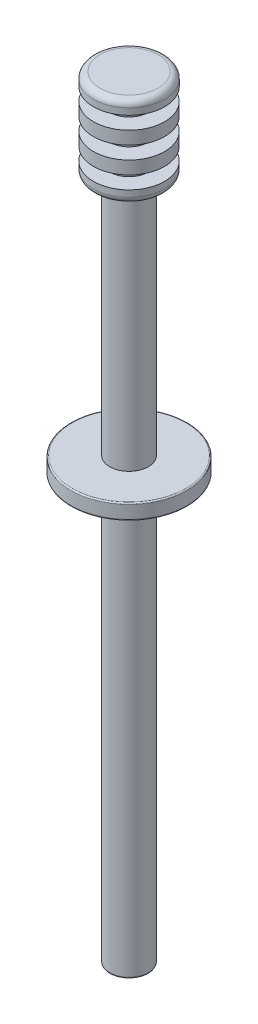
from build123d import *

# Parameters (mm, degrees)
SKETCH1_R            = 2.75
BOSS_EXTRUDE1_DEPTH  = 1
SKETCH2_R            = 1.5
BOSS_EXTRUDE2_DEPTH  = 1
BOSS_EXTRUDE3_START  = 1
SKETCH3_R            = 2.75
BOSS_EXTRUDE3_DEPTH  = 1
SKETCH4_R            = 1.5
BOSS_EXTRUDE4_DEPTH  = 1
BOSS_EXTRUDE5_START  = 1
SKETCH5_R            = 2.75
BOSS_EXTRUDE5_DEPTH  = 1
SKETCH6_R            = 1.5
BOSS_EXTRUDE6_DEPTH  = 1
BOSS_EXTRUDE7_START  = 1
SKETCH7_R            = 2.75
BOSS_EXTRUDE7_DEPTH  = 1
SKETCH8_R            = 1.5
BOSS_EXTRUDE8_DEPTH  = 18.75
SKETCH9_R            = 4.5
BOSS_EXTRUDE9_DEPTH  = 1.2
SKETCH10_R           = 1.5
BOSS_EXTRUDE10_DEPTH = 32.81
FILLET1_R            = 0.5
FILLET2_R            = 0.1
FILLET3_R            = 0.5
FILLET4_R            = 0.1


with BuildPart() as part:
    # Sketch1 → Boss-Extrude1 (new body)
    with BuildSketch(Plane(origin=(0, 0, 0), x_dir=(1, 0, 0), z_dir=(0, 1, 0))):
        Circle(SKETCH1_R)
    extrude(amount=BOSS_EXTRUDE1_DEPTH)

    # Sketch2 → Boss-Extrude2 (add)
    with BuildSketch(Plane.XZ):
        Circle(SKETCH2_R)
    extrude(amount=BOSS_EXTRUDE2_DEPTH)

    # Sketch3 → Boss-Extrude3 (add)
    with BuildSketch(Plane(origin=(0, -1, 0), x_dir=(-1, 0, 0), z_dir=(0, -1, 0)).offset(BOSS_EXTRUDE3_START)):
        Circle(SKETCH3_R)
    extrude(amount=-BOSS_EXTRUDE3_DEPTH)

    # Sketch4 → Boss-Extrude4 (add)
    with BuildSketch(Plane(origin=(0, -2, 0), x_dir=(-1, 0, 0), z_dir=(0, -1, 0))):
        Circle(SKETCH4_R)
    extrude(amount=BOSS_EXTRUDE4_DEPTH)

    # Sketch5 → Boss-Extrude5 (add)
    with BuildSketch(Plane(origin=(0, -3, 0), x_dir=(-1, 0, 0), z_dir=(0, -1, 0)).offset(BOSS_EXTRUDE5_START)):
        Circle(SKETCH5_R)
    extrude(amount=-BOSS_EXTRUDE5_DEPTH)

    # Sketch6 → Boss-Extrude6 (add)
    with BuildSketch(Plane.XZ.offset(4)):
        Circle(SKETCH6_R)
    extrude(amount=BOSS_EXTRUDE6_DEPTH)

    # Sketch7 → Boss-Extrude7 (add)
    with BuildSketch(Plane.XZ.offset(5).offset(BOSS_EXTRUDE7_START)):
        Circle(SKETCH7_R)
    extrude(amount=-BOSS_EXTRUDE7_DEPTH)

    # Sketch8 → Boss-Extrude8 (add)
    with BuildSketch(Plane(origin=(0, -6, 0), x_dir=(-1, 0, 0), z_dir=(0, -1, 0))):
        Circle(SKETCH8_R)
    extrude(amount=BOSS_EXTRUDE8_DEPTH)

    # Sketch9 → Boss-Extrude9 (add)
    with BuildSketch(Plane(origin=(0, -24.75, 0), x_dir=(-1, 0, 0), z_dir=(0, -1, 0))):
        Circle(SKETCH9_R)
    extrude(amount=BOSS_EXTRUDE9_DEPTH)

    # Sketch10 → Boss-Extrude10 (add)
    with BuildSketch(Plane.XZ.offset(25.95)):
        Circle(SKETCH10_R)
    extrude(amount=BOSS_EXTRUDE10_DEPTH)

    # Fillet1
    fillet1_edges = [part.edges().sort_by_distance(p)[0] for p in [
        (-2.75, 1, 0),
    ]]
    fillet(fillet1_edges, radius=FILLET1_R)

    # Fillet2
    fillet2_edges = [part.edges().sort_by_distance(p)[0] for p in [
        (4.5, -24.75, 0),
        (4.5, -25.95, 0),
    ]]
    fillet(fillet2_edges, radius=FILLET2_R)

    # Fillet3
    fillet3_edges = [part.edges().sort_by_distance(p)[0] for p in [
        (-2.75, -6, 0),
    ]]
    fillet(fillet3_edges, radius=FILLET3_R)

    # Fillet4
    fillet4_edges = [part.edges().sort_by_distance(p)[0] for p in [
        (-1.5, -58.76, 0),
    ]]
    fillet(fillet4_edges, radius=FILLET4_R)


solid = part.part
